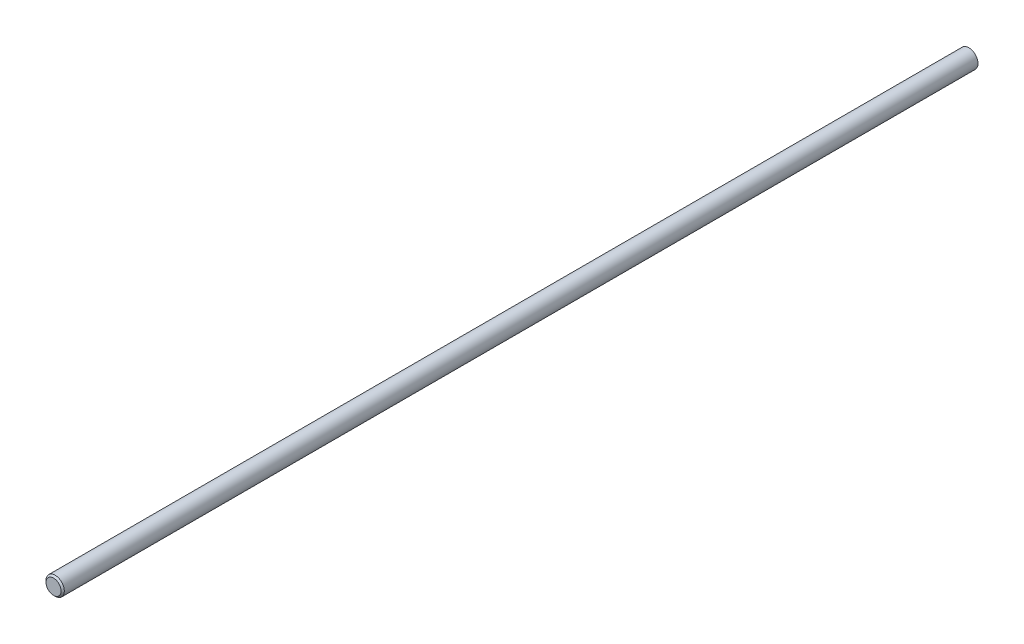
from build123d import *

# Parameters (mm, degrees)
SKETCH1_R           = 2.5
BOSS_EXTRUDE1_DEPTH = 250


# Read off the part's stored shape, not the designer's step: M5 Roscas Standard Taladro1
with BuildPart() as part:
    # Sketch1 → Boss-Extrude1 (new body)
    with BuildSketch(Plane.XY):
        Circle(SKETCH1_R)
    extrude(amount=BOSS_EXTRUDE1_DEPTH)

    # M5 Roscas Standard Taladro1 outline → M5 Roscas Standard Taladro1 (revolve, cut)
    with BuildSketch(Plane.XZ):
        Polygon((2.5, 250), (2.055, 250), (2.5, 249.555), align=None)
    revolve(axis=Axis((0, 0, 0), (0, 0, 1)), mode=Mode.SUBTRACT)


solid = part.part
